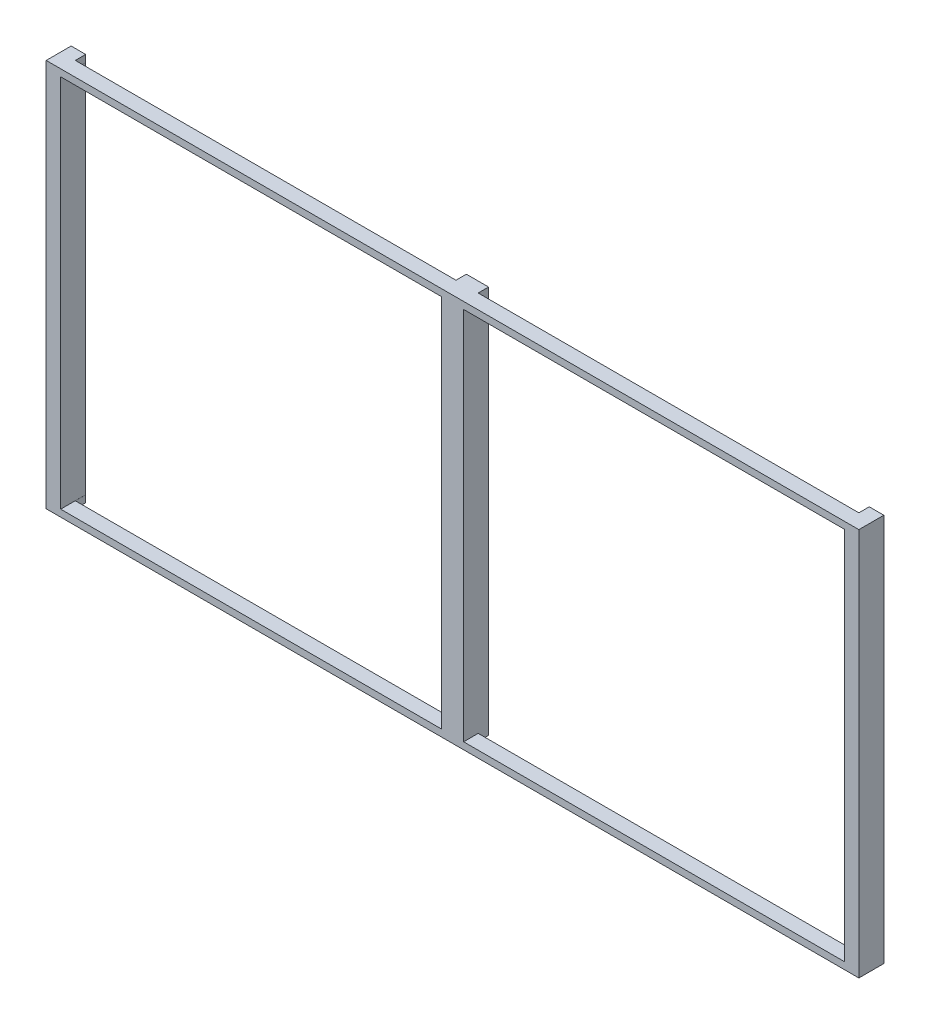
from build123d import *

# Parameters (mm, degrees)
SKETCH_1_W          = 5860
SKETCH_1_H          = 2800
SKETCH_1_W_2        = 2745.357142857
SKETCH_1_H_2        = 2700
EXTRUDE_1_DEPTH     = 180
SKETCH_2_W          = 2745
SKETCH_2_H          = 75
CUT_EXTRUDE_1_DEPTH = 4057.759790769


with BuildPart() as part:
    # Эскиз1 → Бобышка-Вытянуть1 (new body)
    with BuildSketch(Plane.XY):
        Rectangle(SKETCH_1_W, SKETCH_1_H)
        with Locations((-1452.678571429, 0)):
            Rectangle(SKETCH_1_W_2, SKETCH_1_H_2, mode=Mode.SUBTRACT)
        with Locations((1452.678571429, 0)):
            Rectangle(SKETCH_1_W_2, SKETCH_1_H_2, mode=Mode.SUBTRACT)
    extrude(amount=EXTRUDE_1_DEPTH)

    # Эскиз2 → Вырез-Вытянуть1 (cut, through all)
    with BuildSketch(Plane.XZ.offset(1400)):
        with Locations((-1452.5, 37.5)):
            Rectangle(SKETCH_2_W, SKETCH_2_H)
        with Locations((1452.5, 37.5)):
            Rectangle(SKETCH_2_W, SKETCH_2_H)
    extrude(amount=-CUT_EXTRUDE_1_DEPTH, mode=Mode.SUBTRACT)


solid = part.part
